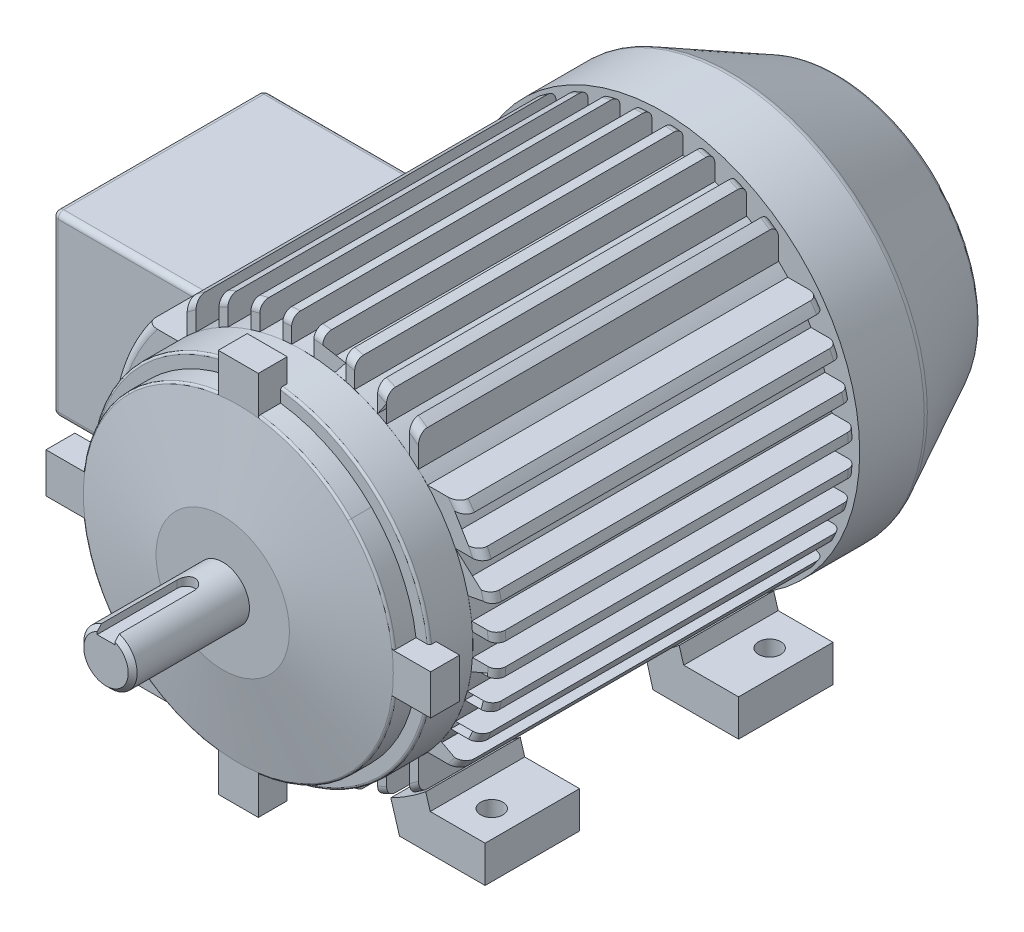
from build123d import *

# Parameters (mm, degrees)
EXTRUIR1_DEPTH        = 162
REDONDEO1_R           = 4
CROQUIS2_R            = 76.5
EXTRUIR2_DEPTH        = 19
CROQUIS3_R            = 70.5
EXTRUIR3_DEPTH        = 10
CROQUIS4_R            = 12
EXTRUIR4_DEPTH        = 59.5
CORTAR_EXTRUIR1_DEPTH = 4
CHAFL_N1_SIZE         = 2
CROQUIS7_R            = 88.5
EXTRUIR5_DEPTH        = 79
CHAFL_N2_SIZE         = 49
CHAFL_N2_SIZE2        = 25
REDONDEO2_R           = 4
EXTRUIR6_START        = -13
EXTRUIR6_DEPTH        = 13
MATRIZC1_COUNT        = 4
EXTRUIR8_DEPTH        = 42.5
EXTRUIR9_DEPTH        = 42.5
CROQUIS11_R           = 5
CORTAR_EXTRUIR2_DEPTH = 18
REDONDEO3_R           = 1
REDONDEO4_R           = 1
EXTRUIR10_DEPTH       = 95
REDONDEO5_R           = 2.5
CROQUIS13_R           = 30
EXTRUIR11_DEPTH       = 7
EXTRUIR11_DRAFT       = 80


with BuildPart() as part:
    # Croquis1 → Extruir1 (new body)
    with BuildSketch(Plane.XY):
        with BuildLine():
            Line((-4.999, 76.336426429), (-4.999, 87.357026048))
            ThreePointArc((-4.999, 87.357026048), (-7.000841082, 87.219402781), (-8.999, 87.035912128))
            Line((-8.999, 87.035912128), (-8.999, 75.968743573))
            ThreePointArc((-8.999, 75.968743573), (-14.199587144, 75.170428526), (-19.333, 74.016528181))
            Line((-19.333, 74.016528181), (-19.333, 85.33725121))
            ThreePointArc((-19.333, 85.33725121), (-21.338927875, 84.857866331), (-23.333, 84.33133726))
            Line((-23.333, 84.33133726), (-23.333, 72.854474427))
            ThreePointArc((-23.333, 72.854474427), (-28.575338757, 70.962263656), (-33.666, 68.693399326))
            Line((-33.666, 68.693399326), (-33.666, 80.763748743))
            ThreePointArc((-33.666, 80.763748743), (-35.677180322, 79.895666021), (-37.666, 78.97751016))
            Line((-37.666, 78.97751016), (-37.666, 66.58413558))
            ThreePointArc((-37.666, 66.58413558), (-42.975948557, 63.286901431), (-47.999, 59.567188955))
            Line((-47.999, 59.567188955), (-47.999, 73.159073258))
            ThreePointArc((-47.999, 73.159073258), (-50.018412545, 71.793512024), (-51.999, 70.372224634))
            Line((-51.999, 70.372224634), (-51.999, 56.109268397))
            ThreePointArc((-51.999, 56.109268397), (-54.092668761, 54.093668761), (-56.108268397, 52))
            Line((-56.108268397, 52), (-70.371224634, 52))
            ThreePointArc((-70.371224634, 52), (-87.499, 0), (-70.371224634, -52))
            Line((-70.371224634, -52), (-56.108268397, -52))
            ThreePointArc((-56.108268397, -52), (-54.092668761, -54.093668761), (-51.999, -56.109268397))
            Line((-51.999, -56.109268397), (-51.999, -70.372224634))
            ThreePointArc((-51.999, -70.372224634), (-50.018412545, -71.793512024), (-47.999, -73.159073258))
            Line((-47.999, -73.159073258), (-47.999, -59.567188955))
            ThreePointArc((-47.999, -59.567188955), (-42.975948557, -63.286901431), (-37.666, -66.58413558))
            Line((-37.666, -66.58413558), (-37.666, -78.97751016))
            ThreePointArc((-37.666, -78.97751016), (-35.677180322, -79.895666021), (-33.666, -80.763748743))
            Line((-33.666, -80.763748743), (-33.666, -68.693399326))
            ThreePointArc((-33.666, -68.693399326), (-28.575338757, -70.962263656), (-23.333, -72.854474427))
            Line((-23.333, -72.854474427), (-23.333, -84.33133726))
            ThreePointArc((-23.333, -84.33133726), (-21.338927875, -84.857866331), (-19.333, -85.33725121))
            Line((-19.333, -85.33725121), (-19.333, -74.016528181))
            ThreePointArc((-19.333, -74.016528181), (-14.199587144, -75.170428526), (-8.999, -75.968743573))
            Line((-8.999, -75.968743573), (-8.999, -87.035912128))
            ThreePointArc((-8.999, -87.035912128), (-7.000841082, -87.219402781), (-4.999, -87.357026048))
            Line((-4.999, -87.357026048), (-4.999, -76.336426429))
            ThreePointArc((-4.999, -76.336426429), (0.001, -76.5), (5.001, -76.336426429))
            Line((5.001, -76.336426429), (5.001, -87.357026048))
            ThreePointArc((5.001, -87.357026048), (7.002841082, -87.219402781), (9.001, -87.035912128))
            Line((9.001, -87.035912128), (9.001, -75.968743573))
            ThreePointArc((9.001, -75.968743573), (14.201587144, -75.170428526), (19.335, -74.016528181))
            Line((19.335, -74.016528181), (19.335, -85.33725121))
            ThreePointArc((19.335, -85.33725121), (21.340927875, -84.857866331), (23.335, -84.33133726))
            Line((23.335, -84.33133726), (23.335, -72.854474427))
            ThreePointArc((23.335, -72.854474427), (28.577338757, -70.962263656), (33.668, -68.693399326))
            Line((33.668, -68.693399326), (33.668, -80.763748743))
            ThreePointArc((33.668, -80.763748743), (35.679180322, -79.895666021), (37.668, -78.97751016))
            Line((37.668, -78.97751016), (37.668, -66.58413558))
            ThreePointArc((37.668, -66.58413558), (42.977948557, -63.286901431), (48.001, -59.567188955))
            Line((48.001, -59.567188955), (48.001, -73.159073258))
            ThreePointArc((48.001, -73.159073258), (50.020412545, -71.793512024), (52.001, -70.372224634))
            Line((52.001, -70.372224634), (52.001, -56.109268397))
            ThreePointArc((52.001, -56.109268397), (54.094668761, -54.093668761), (56.110268397, -52))
            Line((56.110268397, -52), (70.373224634, -52))
            ThreePointArc((70.373224634, -52), (71.794512024, -50.019412545), (73.160073258, -48))
            Line((73.160073258, -48), (59.568188955, -48))
            ThreePointArc((59.568188955, -48), (63.287901431, -42.976948557), (66.58513558, -37.667))
            Line((66.58513558, -37.667), (78.97851016, -37.667))
            ThreePointArc((78.97851016, -37.667), (79.896666021, -35.678180322), (80.764748743, -33.667))
            Line((80.764748743, -33.667), (68.694399326, -33.667))
            ThreePointArc((68.694399326, -33.667), (70.963263656, -28.576338757), (72.855474427, -23.334))
            Line((72.855474427, -23.334), (84.33233726, -23.334))
            ThreePointArc((84.33233726, -23.334), (84.858866331, -21.339927875), (85.33825121, -19.334))
            Line((85.33825121, -19.334), (74.017528181, -19.334))
            ThreePointArc((74.017528181, -19.334), (75.171428526, -14.200587144), (75.969743573, -9))
            Line((75.969743573, -9), (87.036912128, -9))
            ThreePointArc((87.036912128, -9), (87.220402781, -7.001841082), (87.358026048, -5))
            Line((87.358026048, -5), (76.337426429, -5))
            ThreePointArc((76.337426429, -5), (76.501, 0), (76.337426429, 5))
            Line((76.337426429, 5), (87.358026048, 5))
            ThreePointArc((87.358026048, 5), (87.220402781, 7.001841082), (87.036912128, 9))
            Line((87.036912128, 9), (75.969743573, 9))
            ThreePointArc((75.969743573, 9), (75.171428526, 14.200587144), (74.017528181, 19.334))
            Line((74.017528181, 19.334), (85.33825121, 19.334))
            ThreePointArc((85.33825121, 19.334), (84.858866331, 21.339927875), (84.33233726, 23.334))
            Line((84.33233726, 23.334), (72.855474427, 23.334))
            ThreePointArc((72.855474427, 23.334), (70.963263656, 28.576338757), (68.694399326, 33.667))
            Line((68.694399326, 33.667), (80.764748743, 33.667))
            ThreePointArc((80.764748743, 33.667), (79.896666021, 35.678180322), (78.97851016, 37.667))
            Line((78.97851016, 37.667), (66.58513558, 37.667))
            ThreePointArc((66.58513558, 37.667), (63.287901431, 42.976948557), (59.568188955, 48))
            Line((59.568188955, 48), (73.160073258, 48))
            ThreePointArc((73.160073258, 48), (71.794512024, 50.019412545), (70.373224634, 52))
            Line((70.373224634, 52), (56.110268397, 52))
            ThreePointArc((56.110268397, 52), (54.094668761, 54.093668761), (52.001, 56.109268397))
            Line((52.001, 56.109268397), (52.001, 70.372224634))
            ThreePointArc((52.001, 70.372224634), (50.020412545, 71.793512024), (48.001, 73.159073258))
            Line((48.001, 73.159073258), (48.001, 59.567188955))
            ThreePointArc((48.001, 59.567188955), (42.977948557, 63.286901431), (37.668, 66.58413558))
            Line((37.668, 66.58413558), (37.668, 78.97751016))
            ThreePointArc((37.668, 78.97751016), (35.679180322, 79.895666021), (33.668, 80.763748743))
            Line((33.668, 80.763748743), (33.668, 68.693399326))
            ThreePointArc((33.668, 68.693399326), (28.577338757, 70.962263656), (23.335, 72.854474427))
            Line((23.335, 72.854474427), (23.335, 84.33133726))
            ThreePointArc((23.335, 84.33133726), (21.340927875, 84.857866331), (19.335, 85.33725121))
            Line((19.335, 85.33725121), (19.335, 74.016528181))
            ThreePointArc((19.335, 74.016528181), (14.201587144, 75.170428526), (9.001, 75.968743573))
            Line((9.001, 75.968743573), (9.001, 87.035912128))
            ThreePointArc((9.001, 87.035912128), (7.002841082, 87.219402781), (5.001, 87.357026048))
            Line((5.001, 87.357026048), (5.001, 76.336426429))
            ThreePointArc((5.001, 76.336426429), (0.001, 76.5), (-4.999, 76.336426429))
        make_face()
    extrude(amount=-EXTRUIR1_DEPTH)

    # Redondeo1
    redondeo1_edges = [part.edges().sort_by_distance(p)[0] for p in [
        (-50.018412545, -71.793512024, -162),
        (-35.677180322, -79.895666021, -162),
        (-21.338927875, -84.857866331, -162),
        (-7.000841082, -87.219402781, -162),
        (7.002841082, -87.219402781, -162),
        (21.340927875, -84.857866331, -162),
        (35.679180322, -79.895666021, -162),
        (50.020412545, -71.793512024, -162),
        (71.794512024, -50.019412545, -162),
        (79.896666021, -35.678180322, -162),
        (84.858866331, -21.339927875, -162),
        (87.220402781, -7.001841082, -162),
        (87.220402781, 7.001841082, -162),
        (84.858866331, 21.339927875, -162),
        (79.896666021, 35.678180322, -162),
        (71.794512024, 50.019412545, -162),
        (50.020412545, 71.793512024, -162),
        (35.679180322, 79.895666021, -162),
        (21.340927875, 84.857866331, -162),
        (7.002841082, 87.219402781, -162),
        (-7.000841082, 87.219402781, -162),
        (-21.338927875, 84.857866331, -162),
        (-35.677180322, 79.895666021, -162),
        (-50.018412545, 71.793512024, -162),
        (-87.499, 0, -162),
        (-87.499, 0, 0),
        (-7.000841082, -87.219402781, 0),
        (-21.338927875, -84.857866331, 0),
        (-35.677180322, -79.895666021, 0),
        (-50.018412545, -71.793512024, 0),
        (7.002841082, -87.219402781, 0),
        (21.340927875, -84.857866331, 0),
        (35.679180322, -79.895666021, 0),
        (50.020412545, -71.793512024, 0),
        (71.794512024, -50.019412545, 0),
        (79.896666021, -35.678180322, 0),
        (84.858866331, -21.339927875, 0),
        (87.220402781, -7.001841082, 0),
        (87.220402781, 7.001841082, 0),
        (84.858866331, 21.339927875, 0),
        (79.896666021, 35.678180322, 0),
        (71.794512024, 50.019412545, 0),
        (50.020412545, 71.793512024, 0),
        (35.679180322, 79.895666021, 0),
        (21.340927875, 84.857866331, 0),
        (7.002841082, 87.219402781, 0),
        (-7.000841082, 87.219402781, 0),
        (-21.338927875, 84.857866331, 0),
        (-35.677180322, 79.895666021, 0),
        (-50.018412545, 71.793512024, 0),
    ]]
    fillet(redondeo1_edges, radius=REDONDEO1_R)

    # Croquis2 → Extruir2 (add)
    with BuildSketch(Plane.XY):
        Circle(CROQUIS2_R)
    extrude(amount=EXTRUIR2_DEPTH)

    # Croquis3 → Extruir3 (add)
    with BuildSketch(Plane.XY.offset(19)):
        Circle(CROQUIS3_R)
    extruir3 = extrude(amount=EXTRUIR3_DEPTH)

    # Croquis4 → Extruir4 (add)
    with BuildSketch(Plane.XY.offset(29)):
        Circle(CROQUIS4_R)
    extrude(amount=EXTRUIR4_DEPTH)

    # Croquis5 → Cortar-Extruir1 (cut)
    with BuildSketch(Plane(origin=(0, 12, 0), x_dir=(-1, 0, 0), z_dir=(0, 1, 0))):
        with BuildLine():
            Line((-4.0005, 88.5), (3.9995, 88.5))
            Line((3.9995, 88.5), (3.9995, 52.5))
            ThreePointArc((3.9995, 52.5), (-0.0005, 48.5), (-4.0005, 52.5))
            Line((-4.0005, 52.5), (-4.0005, 88.5))
        make_face()
    extrude(amount=-CORTAR_EXTRUIR1_DEPTH, mode=Mode.SUBTRACT)

    # Chaflán1
    chafl_n1_edges = [part.edges().sort_by_distance(p)[0] for p in [
        (-6.928419733, -9.797805877, 88.5),
    ]]
    chamfer(chafl_n1_edges, length=CHAFL_N1_SIZE)

    # Croquis7 → Extruir5 (add)
    with BuildSketch(Plane(origin=(0, 0, -162), x_dir=(-1, 0, 0), z_dir=(0, 0, -1))):
        Circle(CROQUIS7_R)
    extrude(amount=EXTRUIR5_DEPTH)

    # Chaflán2
    chafl_n2_edges = [part.edges().sort_by_distance(p)[0] for p in [
        (88.5, 0, -241),
    ]]
    chafl_n2_side = [part.faces().sort_by_distance(p)[0] for p in [
        (88.5, 0, -201.5),
    ]]
    chamfer(chafl_n2_edges, length=CHAFL_N2_SIZE, length2=CHAFL_N2_SIZE2, reference=chafl_n2_side[0])

    # Redondeo2
    redondeo2_edges = [part.edges().sort_by_distance(p)[0] for p in [
        (88.5, 0, -192),
        (63.5, 0, -241),
    ]]
    fillet(redondeo2_edges, radius=REDONDEO2_R)

    # Croquis8 → Extruir6 (add)
    with BuildSketch(Plane.XY.offset(29).offset(EXTRUIR6_START)):
        with BuildLine():
            Line((-9, 86.5), (9, 86.5))
            Line((9, 86.5), (9, 69.923172125))
            ThreePointArc((9, 69.923172125), (0, 70.5), (-9, 69.923172125))
            Line((-9, 69.923172125), (-9, 86.5))
        make_face()
    extruir6 = extrude(amount=EXTRUIR6_DEPTH)

    # MatrizC1: Extruir3, Extruir6 ×4 about axis
    matrizc1_axis = Axis((0.001, 0, -162), (0, 0, 1))
    add([extruir3.rotate(matrizc1_axis, i * 360 / MATRIZC1_COUNT) for i in range(1, MATRIZC1_COUNT)])
    add([extruir6.rotate(matrizc1_axis, i * 360 / MATRIZC1_COUNT) for i in range(1, MATRIZC1_COUNT)])

    # Croquis9 → Extruir8 (add)
    with BuildSketch(Plane.XY):
        with BuildLine():
            Line((-82, -91), (-43.5, -91))
            Line((-43.5, -91), (-39.5895, -78.031541634))
            ThreePointArc((-39.5895, -78.031541634), (-47.72254593, -73.340361398), (-55.306117298, -67.804744594))
            Line((-55.306117298, -67.804744594), (-57.325, -74.5))
            Line((-57.325, -74.5), (-82, -74.5))
            Line((-82, -74.5), (-82, -91))
        make_face()
        with BuildLine():
            Line((82, -74.5), (82, -91))
            Line((82, -91), (43.5, -91))
            Line((43.5, -91), (39.5895, -78.031541634))
            ThreePointArc((39.5895, -78.031541634), (47.72254593, -73.340361398), (55.306117298, -67.804744594))
            Line((55.306117298, -67.804744594), (57.325, -74.5))
            Line((57.325, -74.5), (82, -74.5))
        make_face()
    extrude(amount=-EXTRUIR8_DEPTH)


with BuildPart() as extruir8_piece_1:
    # of the separate pieces the step leaves, piece 1, a body of its own (extruir8_pieces)
    add(part.part.solids().sort_by_distance((-88.5, 0, -191.038545575))[0])

    # Croquis10 → Extruir9 (add)
    with BuildSketch(Plane.XY.offset(-114)):
        with BuildLine():
            Line((43.5, -91), (82, -91))
            Line((82, -91), (82, -74.5))
            Line((82, -74.5), (57.325, -74.5))
            Line((57.325, -74.5), (55.306117298, -67.804744594))
            ThreePointArc((55.306117298, -67.804744594), (47.832950166, -73.268403002), (39.824367682, -77.911935791))
            Line((39.824367682, -77.911935791), (43.5, -91))
        make_face()
        with BuildLine():
            Line((-55.306117298, -67.804744594), (-57.325, -74.5))
            Line((-57.325, -74.5), (-82, -74.5))
            Line((-82, -74.5), (-82, -91))
            Line((-82, -91), (-43.5, -91))
            Line((-43.5, -91), (-39.5895, -78.031541634))
            ThreePointArc((-39.5895, -78.031541634), (-47.72254593, -73.340361398), (-55.306117298, -67.804744594))
        make_face()
    extrude(amount=-EXTRUIR9_DEPTH)


with BuildPart() as extruir8_piece_2:
    # of the separate pieces the step leaves, piece 2, a body of its own (extruir8_pieces)
    add(part.part.solids().sort_by_distance((-82, -91, 0))[0])


with BuildPart() as extruir9_piece_1:
    # of the separate pieces the step leaves, piece 1, a body of its own (extruir9_pieces)
    add(extruir8_piece_1.part.solids().sort_by_distance((-88.5, 0, -191.038545575))[0])


with BuildPart() as extruir9_piece_2:
    # of the separate pieces the step leaves, piece 2, a body of its own (extruir9_pieces)
    add(extruir8_piece_1.part.solids().sort_by_distance((-39.5895, -78.031541634, -114))[0])


with BuildPart() as cortar_extruir2_tool:
    # Croquis11 → Cortar-Extruir2 (new body)
    with BuildSketch(Plane.XZ.offset(91)):
        with Locations((-69.9995, -15)):
            Circle(CROQUIS11_R)
        with Locations((70.0005, -15)):
            Circle(CROQUIS11_R)
        with Locations((70.0005, -140)):
            Circle(CROQUIS11_R)
        with Locations((-69.9995, -140)):
            Circle(CROQUIS11_R)
    extrude(amount=-CORTAR_EXTRUIR2_DEPTH)


with BuildPart() as extruir8_piece_2_1:
    add(extruir8_piece_2.part)

    # Cortar-Extruir2: cut by cortar_extruir2_tool
    add(cortar_extruir2_tool.part, mode=Mode.SUBTRACT)


with BuildPart() as extruir9_piece_1_1:
    add(extruir9_piece_1.part)

    # Cortar-Extruir2: cut by cortar_extruir2_tool
    add(cortar_extruir2_tool.part, mode=Mode.SUBTRACT)

    # Redondeo3
    redondeo3_edges = [extruir9_piece_1_1.edges().sort_by_distance(p)[0] for p in [
        (63.276598259, -31.08979278, 29),
        (-31.08879278, -63.275598259, 29),
        (63.276153625, 31.090697693, 29),
        (31.091697693, -63.275153625, 29),
        (-63.274153625, -31.090697693, 29),
        (-63.274598259, 31.08979278, 29),
        (-31.089697693, 63.275153625, 29),
        (31.09079278, 63.275598259, 29),
    ]]
    fillet(redondeo3_edges, radius=REDONDEO3_R)

    # Redondeo4
    redondeo4_edges = [extruir9_piece_1_1.edges().sort_by_distance(p)[0] for p in [
        (-54.092600674, -54.094736827, 19),
        (-54.094024785, 54.093312734, 19),
        (54.094736829, -54.092600672, 19),
        (54.093312733, 54.094024786, 19),
    ]]
    fillet(redondeo4_edges, radius=REDONDEO4_R)


with BuildPart() as extruir9_piece_2_1:
    add(extruir9_piece_2.part)

    # Cortar-Extruir2: cut by cortar_extruir2_tool
    add(cortar_extruir2_tool.part, mode=Mode.SUBTRACT)


with BuildPart() as body_4:
    # Croquis12 → Extruir10 (new body)
    with BuildSketch(Plane.XY.offset(-130)):
        with BuildLine():
            Line((-77.821912081, 40), (-147.5, 40))
            Line((-147.5, 40), (-147.5, -40))
            Line((-147.5, -40), (-77.821912081, -40))
            ThreePointArc((-77.821912081, -40), (-87.5, 0), (-77.821912081, 40))
        make_face()
    extrude(amount=EXTRUIR10_DEPTH)

    # Redondeo5
    redondeo5_edges = [body_4.edges().sort_by_distance(p)[0] for p in [
        (-147.5, 40, -82.5),
        (-147.5, -40, -82.5),
        (-147.5, 0, -35),
        (-147.5, 0, -130),
        (-112.660956041, -40, -130),
        (-112.660956041, -40, -35),
        (-112.660956041, 40, -130),
        (-112.660956041, 40, -35),
    ]]
    fillet(redondeo5_edges, radius=REDONDEO5_R)


with BuildPart() as extruir11_tool:
    # Croquis13 → Extruir11 (with draft: the straight prism first)
    with BuildSketch(Plane.XY.offset(36)):
        Circle(CROQUIS13_R)
    extrude(amount=-EXTRUIR11_DEPTH)
    # Extruir11: the draft: its side faces are tilted about the plane it starts from
    extruir11_sides = [extruir11_tool.faces().sort_by_distance(p)[0] for p in [
        (-30, 0, 32.5),
    ]]
    draft(extruir11_sides, Plane.XY.offset(36), EXTRUIR11_DRAFT)


with BuildPart() as extruir9_piece_1_2:
    add(extruir9_piece_1_1.part)

    # Extruir11: add extruir11_tool
    add(extruir11_tool.part)


solid = Compound([extruir8_piece_2_1.part, extruir9_piece_2_1.part, body_4.part, extruir9_piece_1_2.part])
